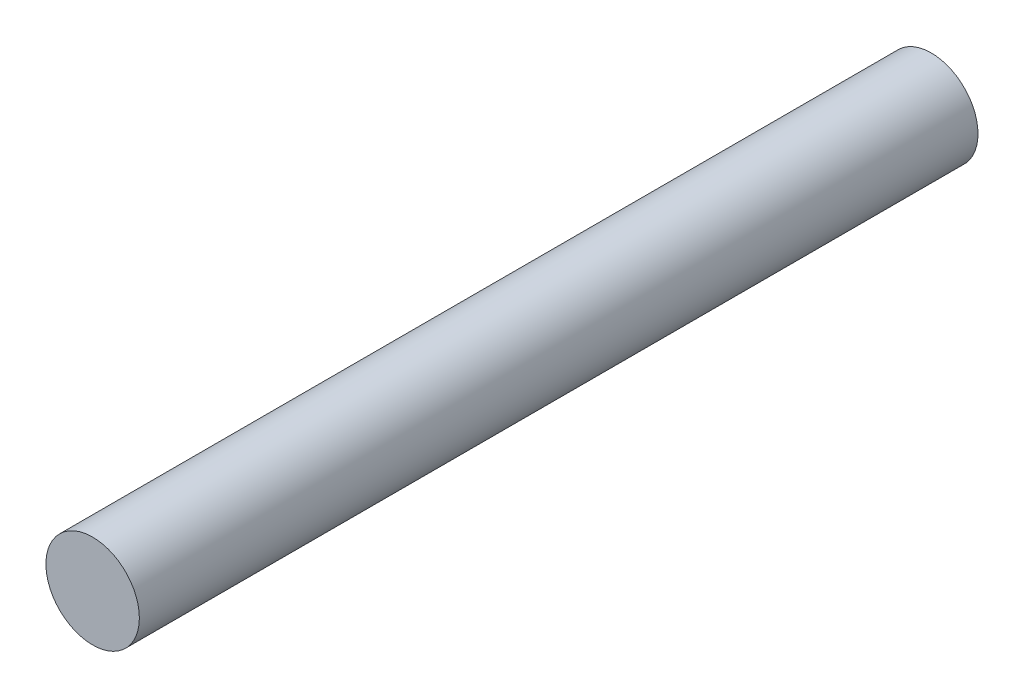
from build123d import *

# Parameters (mm, degrees)
SKETCH1_R           = 3.9
BOSS_EXTRUDE1_DEPTH = 70


with BuildPart() as part:
    # Sketch1 → Boss-Extrude1 (new body)
    with BuildSketch(Plane.XY):
        Circle(SKETCH1_R)
    extrude(amount=BOSS_EXTRUDE1_DEPTH)


solid = part.part
